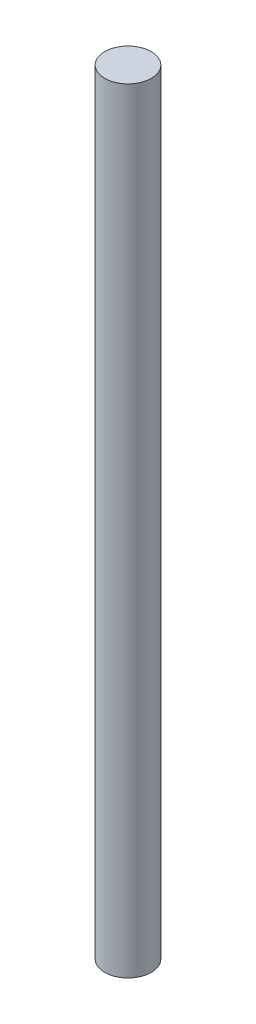
from build123d import *

# Parameters (mm, degrees)
SKETCH1_R           = 7.5
BOSS_EXTRUDE1_DEPTH = 250


with BuildPart() as part:
    # Sketch1 → Boss-Extrude1 (new body)
    with BuildSketch(Plane(origin=(0, 0, 0), x_dir=(1, 0, 0), z_dir=(0, 1, 0))):
        Circle(SKETCH1_R)
    extrude(amount=BOSS_EXTRUDE1_DEPTH)


solid = part.part
